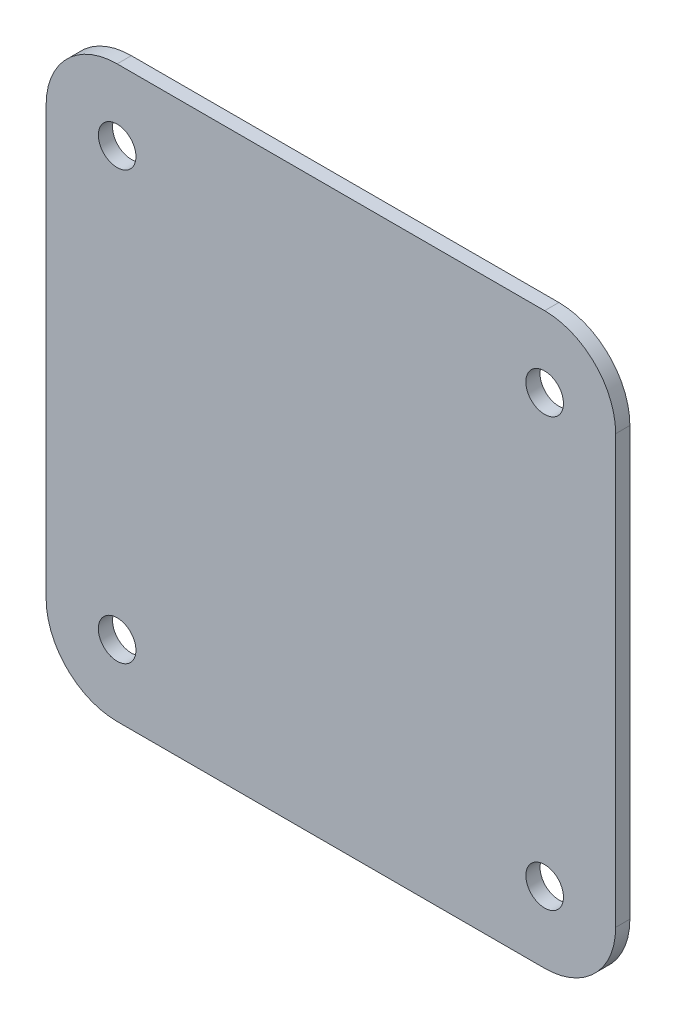
from build123d import *

# Parameters (mm, degrees)
SKETCH1_W            = 80.2
SKETCH1_H            = 80.2
BOSS_EXTRUDE1_DEPTH  = 2
M5_CLEARANCE_HOLE1_D = 5.3
FILLET1_R            = 10


with BuildPart() as part:
    # Sketch1 → Boss-Extrude1 (new body)
    with BuildSketch(Plane.XY):
        Rectangle(SKETCH1_W, SKETCH1_H)
    extrude(amount=BOSS_EXTRUDE1_DEPTH)

    # M5 Clearance Hole1 (through all)
    with Locations(Plane(origin=(30.1, 30.1, 0), x_dir=(-1, 0, 0), z_dir=(0, 0, -1))):
        with Locations((0, 0), (60.2, 0), (60.2, -60.2), (0, -60.2)):
            Hole(M5_CLEARANCE_HOLE1_D / 2)

    # Fillet1
    fillet1_edges = [part.edges().sort_by_distance(p)[0] for p in [
        (-40.1, 40.1, 1),
        (-40.1, -40.1, 1),
        (40.1, -40.1, 1),
        (40.1, 40.1, 1),
    ]]
    fillet(fillet1_edges, radius=FILLET1_R)


solid = part.part
